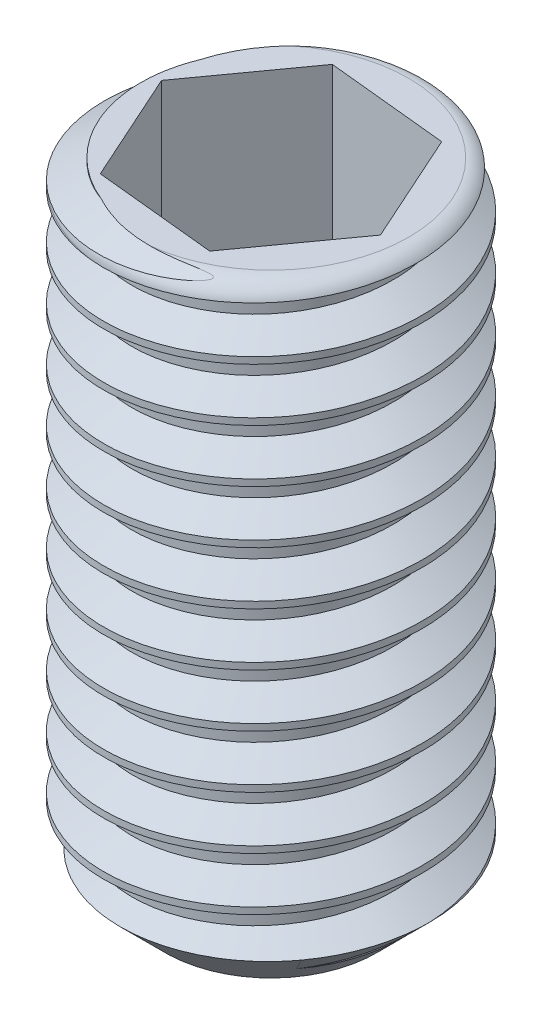
from build123d import *

# Parameters (mm, degrees)
CUT_EXTRUDE_1_DEPTH = 5
FILLET_1_R          = 0.2
THREAD_1_PITCH      = 0.5


with BuildPart() as part:
    # Sketch 1 → Повернуть1 (revolve)
    with BuildSketch(Plane(origin=(0, 0, 0), x_dir=(0, 0, -1), z_dir=(1, 0, 0)), mode=Mode.PRIVATE) as revolve_1_sk:
        Polygon((0, 0), (0, 6), (-1.5, 6), (-1.5, 0.5), (-1, 0), align=None)
    revolve(revolve_1_sk.sketch.rotate(Axis((0, 0, 0), (0, 1, 0)), 180), axis=Axis((0, 0, 0), (0, 1, 0)))

    # Эскиз2 → Вырез-Вытянуть1 (cut)
    with BuildSketch(Plane(origin=(0, 6, 0), x_dir=(1, 0, 0), z_dir=(0, 1, 0))):
        Polygon((0.674672258, 0.937096942), (-0.474213629, 1.052831785), (-1.148885886, 0.115734843), (-0.674672258, -0.937096942), (0.474213629, -1.052831785), (1.148885886, -0.115734843), align=None)
    extrude(amount=-CUT_EXTRUDE_1_DEPTH, mode=Mode.SUBTRACT)

    # Скругление1
    fillet_1_edges = [part.edges().sort_by_distance(p)[0] for p in [
        (0, 6, 1.5),
    ]]
    fillet(fillet_1_edges, radius=FILLET_1_R)

    # Резьба1: the profile of Sketch 1 2 profile screwed along a right-hand helix of 20 turns, 6 arcs to a turn; built about Z, then put on its axis
    thread_1_z = Axis((0, 0, 0), (0, 0, 1))
    thread_1_corners = [(1.5003, 0, -0.000173205), (1.5003, 0, 0.437673204), (1.229367063, 0, 0.281249999), (1.229367062, 0, 0.156249999)]
    with BuildLine(mode=Mode.PRIVATE) as thread_1_profile:
        Line(thread_1_corners[0], thread_1_corners[1])
        Line(thread_1_corners[1], thread_1_corners[2])
        Line(thread_1_corners[2], thread_1_corners[3])
        Line(thread_1_corners[3], thread_1_corners[0])
    thread_1_cap = Face(thread_1_profile.wire())
    thread_1_turn_angles = [0, 30, 60, 90, 120, 150, 180, 210, 240, 270, 300, 330, 360]
    thread_1_turn_weights = [1, 0.8660254037844387, 1, 0.8660254037844387, 1, 0.8660254037844387, 1, 0.8660254037844387, 1, 0.8660254037844387, 1, 0.8660254037844387, 1]
    thread_1_turn_rails = [Edge.make_bspline([Vector(p[0], p[1], 0).rotate(thread_1_z, thread_1_turn_angles[k]) / thread_1_turn_weights[k] + Vector(0, 0, p[2] + THREAD_1_PITCH * thread_1_turn_angles[k] / 360) for k in range(13)], [0, 0, 0, 1, 1, 2, 2, 3, 3, 4, 4, 5, 5, 6, 6, 6], 2, thread_1_turn_weights) for p in thread_1_corners]
    thread_1_turn_sides = [Face.make_surface_from_curves(thread_1_turn_rails[p[0]], thread_1_turn_rails[p[1]]) for p in [(0, 1), (1, 2), (2, 3), (3, 0)]]
    thread_1 = Plane(origin=(0, -0.5, 0), x_dir=(1, 0, 0), z_dir=(0, 1, 0)) * Solid(Shell([*[p.moved(Location((0, 0, THREAD_1_PITCH * i))) for i in range(20) for p in thread_1_turn_sides], thread_1_cap, thread_1_cap.rotate(thread_1_z, 7200).moved(Location((0, 0, THREAD_1_PITCH * 7200 / 360)))]))
    add(thread_1, mode=Mode.SUBTRACT)


solid = part.part
